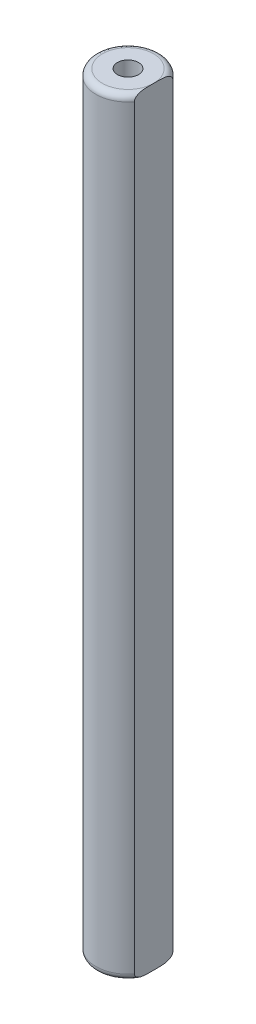
from build123d import *

# Parameters (mm, degrees)
SKETCH1_R            = 2.5
BOSS_EXTRUDE1_DEPTH  = 30
SKETCH2_R            = 0.825
CUT_EXTRUDE1_DEPTH   = 5
CUT_EXTRUDE2_DEPTH   = 31.207614934
FILLET1_R            = 0.5
FILLET1_OF_MIRROR1_R = 0.5


with BuildPart() as part:
    # Sketch1 → Boss-Extrude1 (new body)
    with BuildSketch(Plane(origin=(0, 0, 0), x_dir=(1, 0, 0), z_dir=(0, 1, 0))):
        with Locations(Location((0, 0, 0), (0, 0, 270))):
            Circle(SKETCH1_R)
    boss_extrude1 = extrude(amount=BOSS_EXTRUDE1_DEPTH)

    # Sketch2 → Cut-Extrude1 (cut)
    with BuildSketch(Plane(origin=(0, 30, 0), x_dir=(1, 0, 0), z_dir=(0, 1, 0))):
        with Locations(Location((0, 0, 0), (0, 0, 270))):
            Circle(SKETCH2_R)
    cut_extrude1 = extrude(amount=-CUT_EXTRUDE1_DEPTH, mode=Mode.SUBTRACT)

    # Sketch3 → Cut-Extrude2 (cut, through all)
    with BuildSketch(Plane(origin=(0, 30, 0), x_dir=(1, 0, 0), z_dir=(0, 1, 0))):
        with BuildLine():
            Line((2, 1.5), (2, -1.5))
            ThreePointArc((2, -1.5), (2.5, 0), (2, 1.5))
        make_face()
    cut_extrude2 = extrude(amount=-CUT_EXTRUDE2_DEPTH, mode=Mode.SUBTRACT)

    # Fillet1
    fillet1_edges = [part.edges().sort_by_distance(p)[0] for p in [
        (-2.5, 30, 0),
    ]]
    fillet(fillet1_edges, radius=FILLET1_R - 0.0001)  # a hair under: the kernel refuses the full size

    # Mirror1: Boss-Extrude1, Cut-Extrude1, Cut-Extrude2 across plane
    add(boss_extrude1.mirror(Plane.ZX))
    add(cut_extrude1.mirror(Plane.ZX), mode=Mode.SUBTRACT)
    add(cut_extrude2.mirror(Plane.ZX), mode=Mode.SUBTRACT)

    # Fillet1 of Mirror1
    fillet1_of_mirror1_edges = [part.edges().sort_by_distance(p)[0] for p in [
        (-2.5, -30, 0),
    ]]
    fillet(fillet1_of_mirror1_edges, radius=FILLET1_OF_MIRROR1_R - 0.0001)  # a hair under: the kernel refuses the full size


solid = part.part
